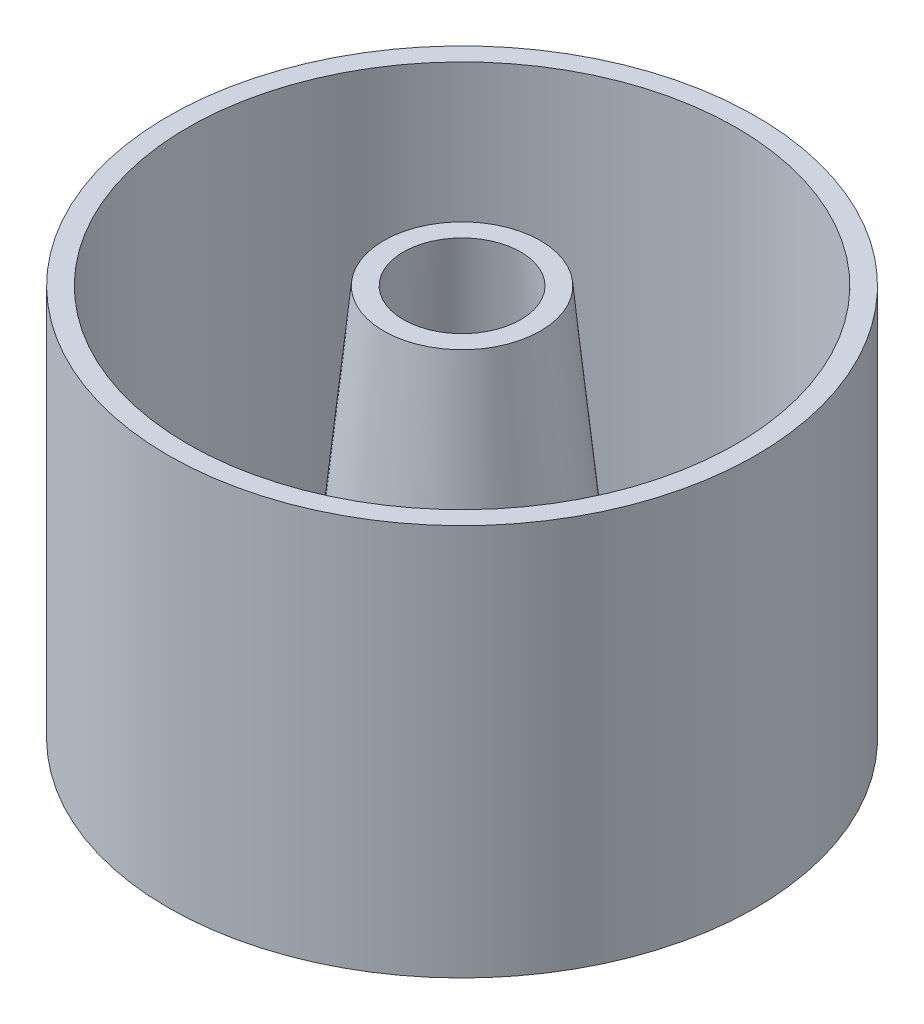
from build123d import *

# Parameters (mm, degrees)
SKETCH1_R           = 75
BOSS_EXTRUDE1_DEPTH = 100
SHELL1_T            = -5
SKETCH3_R           = 20
SKETCH2_R           = 30
FILLET2_R           = 10


# Read off the part's stored shape, not the designer's step: Shell2
with BuildPart() as part:
    # Sketch1 → Boss-Extrude1 (new body)
    with BuildSketch(Plane(origin=(0, 0, 0), x_dir=(1, 0, 0), z_dir=(0, 1, 0))):
        with Locations(Location((0, 0, 0), (0, 0, 270))):
            Circle(SKETCH1_R)
    extrude(amount=BOSS_EXTRUDE1_DEPTH)

    # Shell1
    shell1_openings = [part.faces().sort_by_distance(p)[0] for p in [
        (0, 100, 0),
    ]]
    offset(amount=SHELL1_T, openings=shell1_openings, kind=Kind.INTERSECTION)

    # Sketch3 → Loft1 section 0
    with BuildSketch(Plane(origin=(0, 100, 0), x_dir=(1, 0, 0), z_dir=(0, 1, 0))):
        Circle(SKETCH3_R)
    # Sketch2 → Loft1 section 1
    with BuildSketch(Plane.XZ):
        Circle(SKETCH2_R)
    loft()

    # Shell2 outline → Shell2 (revolve, cut)
    with BuildSketch(Plane.XY):
        Polygon((0, 0), (24.975062189, 0), (14.975062189, 100), (0, 100), align=None)
    revolve(axis=Axis((0, 0, 0), (0, 1, 0)), mode=Mode.SUBTRACT)

    # Fillet1
    # an asymmetric fillet: 30, 5 mm, written as the material it takes off along each edge
    with BuildSketch(Plane(origin=(0, 0, 0), x_dir=(1, 0, 0), z_dir=(0, 0, 1))) as fillet1_piece_1:
        with BuildLine():
            Bezier((54.624689052, 0), (24.975062189, 0), (24.773573346, 2.014888429), weights=[1, 0.741452534, 1])
            Line((24.773573346, 2.014888429), (24.975062189, 0))
            Line((24.975062189, 0), (54.624689052, 0))
        make_face()
    revolve(axis=Axis((0, 0, 0), (0, 1, 0)), mode=Mode.SUBTRACT)

    # Fillet2
    fillet2_edges = [part.edges().sort_by_distance(p)[0] for p in [
        (-29.5, 5, 0),
    ]]
    fillet(fillet2_edges, radius=FILLET2_R)


solid = part.part
